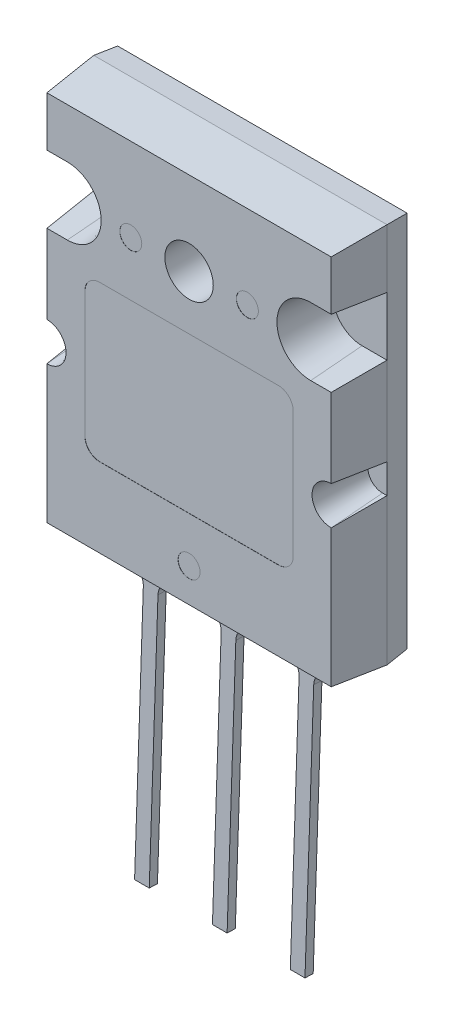
from build123d import *

# Parameters (mm, degrees)
SKETCH1_W                    = 20
SKETCH1_H                    = 26
BOSS_EXTRUDE1_DEPTH          = 1.5
BOSS_EXTRUDE1_DRAFT          = -5
SKETCH1_2_W                  = 20
SKETCH1_2_H                  = 26
BOSS_EXTRUDE2_DEPTH          = 3.5
BOSS_EXTRUDE2_TAPER          = 5
CUT_EXTRUDE1_DEPTH           = 3.5
CUT_EXTRUDE1_TAPER           = -5
CUT_EXTRUDE1_2_DEPTH         = 3.5
CUT_EXTRUDE1_2_TAPER         = -5
CUT_EXTRUDE1_3_DEPTH         = 3.5
CUT_EXTRUDE1_3_TAPER         = -5
CUT_EXTRUDE1_4_DEPTH         = 3.5
CUT_EXTRUDE1_4_TAPER         = -5
CUT_EXTRUDE3_DEPTH           = 17.770509989
CUT_EXTRUDE3_DEPTH_BACK      = 17.770509989
SKETCH5_5_R                  = 1.65
CUT_EXTRUDE4_START           = 3.5
SKETCH5_8_R                  = 0.75
CUT_EXTRUDE4_DEPTH           = 0.01
CUT_EXTRUDE5_START           = -1.5
SKETCH5_9_R                  = 1
CUT_EXTRUDE5_DEPTH           = 1
CUT_EXTRUDE5_DRAFT           = 30
CUT_EXTRUDE5_PROFILE_2_DEPTH = 1
CUT_EXTRUDE5_PROFILE_2_DRAFT = 30
SKETCH6_R                    = 3.5
CUT_EXTRUDE6_DEPTH           = 0.0001
SKETCH7_W                    = 3
SKETCH7_H                    = 0.56
SKETCH7_W_2                  = 2.5
BOSS_EXTRUDE3_DEPTH          = 2.1
SKETCH8_W                    = 1
SKETCH8_H                    = 0.56
BOSS_EXTRUDE4_DEPTH          = 18
FILLET1_R                    = 1


# Read off the part's stored shape, not the designer's step: Cut-Extrude1
with BuildPart() as part:
    # Sketch1 → Boss-Extrude1 (with draft: the straight prism first)
    with BuildSketch(Plane.XY):
        Rectangle(SKETCH1_W, SKETCH1_H)
    extrude(amount=-BOSS_EXTRUDE1_DEPTH)
    # Boss-Extrude1: the draft: its side faces are tilted about the plane it starts from
    boss_extrude1_sides = [part.faces().sort_by_distance(p)[0] for p in [
        (-10, 0, -0.75),
        (0, -13, -0.75),
        (10, 0, -0.75),
        (0, 13, -0.75),
    ]]
    draft(boss_extrude1_sides, Plane.XY, BOSS_EXTRUDE1_DRAFT)

    # Sketch1<2> → Boss-Extrude2 (add)
    with BuildSketch(Plane.XY):
        Rectangle(SKETCH1_2_W, SKETCH1_2_H)
    extrude(amount=BOSS_EXTRUDE2_DEPTH, taper=BOSS_EXTRUDE2_TAPER)

    # Cut-Extrude1 outline → Cut-Extrude1 (cut)
    with BuildSketch(Plane.XY):
        with BuildLine():
            Line((10, -1), (9.693789678, -1))
            ThreePointArc((9.693789678, -1), (8.693789678, -2), (9.693789678, -3))
            Line((9.693789678, -3), (10, -3))
            Line((10, -3), (10, -1))
        make_face()
    extrude(amount=CUT_EXTRUDE1_DEPTH, taper=CUT_EXTRUDE1_TAPER, mode=Mode.SUBTRACT)

    # Cut-Extrude1 2 outline → Cut-Extrude1 2 (cut)
    with BuildSketch(Plane.XY):
        with BuildLine():
            Line((-9.693789678, -1), (-10, -1))
            Line((-10, -1), (-10, -3))
            Line((-10, -3), (-9.693789678, -3))
            ThreePointArc((-9.693789678, -3), (-8.693789678, -2), (-9.693789678, -1))
        make_face()
    extrude(amount=CUT_EXTRUDE1_2_DEPTH, taper=CUT_EXTRUDE1_2_TAPER, mode=Mode.SUBTRACT)

    # Cut-Extrude1 3 outline → Cut-Extrude1 3 (cut)
    with BuildSketch(Plane.XY):
        with BuildLine():
            Line((-8.3, 9), (-10, 9))
            Line((-10, 9), (-10, 5))
            Line((-10, 5), (-8.3, 5))
            ThreePointArc((-8.3, 5), (-6.3, 7), (-8.3, 9))
        make_face()
    extrude(amount=CUT_EXTRUDE1_3_DEPTH, taper=CUT_EXTRUDE1_3_TAPER, mode=Mode.SUBTRACT)

    # Cut-Extrude1 4 outline → Cut-Extrude1 4 (cut)
    with BuildSketch(Plane.XY):
        with BuildLine():
            Line((10, 9), (8.3, 9))
            ThreePointArc((8.3, 9), (6.3, 7), (8.3, 5))
            Line((8.3, 5), (10, 5))
            Line((10, 5), (10, 9))
        make_face()
    extrude(amount=CUT_EXTRUDE1_4_DEPTH, taper=CUT_EXTRUDE1_4_TAPER, mode=Mode.SUBTRACT)

    # Sketch5<5> → Cut-Extrude3 (cut, two sides: drawn at the far end of the back side and taken through both)
    with BuildSketch(Plane.XY.offset(-CUT_EXTRUDE3_DEPTH_BACK)):
        with Locations((0, 7)):
            Circle(SKETCH5_5_R)
    extrude(amount=CUT_EXTRUDE3_DEPTH + CUT_EXTRUDE3_DEPTH_BACK, mode=Mode.SUBTRACT)

    # Sketch5<8> → Cut-Extrude4 (cut)
    with BuildSketch(Plane.XY.offset(CUT_EXTRUDE4_START)):
        with Locations((3.975, 7)):
            Circle(SKETCH5_8_R)
        with Locations((-3.975, 7)):
            Circle(SKETCH5_8_R)
        with Locations((0, -10.4)):
            Circle(SKETCH5_8_R)
        with BuildLine():
            Line((-6.1, 3.3), (6.1, 3.3))
            ThreePointArc((6.1, 3.3), (6.807106781, 3.007106781), (7.1, 2.3))
            Line((7.1, 2.3), (7.1, -6.3))
            ThreePointArc((7.1, -6.3), (6.807106781, -7.007106781), (6.1, -7.3))
            Line((6.1, -7.3), (-6.1, -7.3))
            ThreePointArc((-6.1, -7.3), (-6.807106781, -7.007106781), (-7.1, -6.3))
            Line((-7.1, -6.3), (-7.1, 2.3))
            ThreePointArc((-7.1, 2.3), (-6.807106781, 3.007106781), (-6.1, 3.3))
        make_face()
    extrude(amount=-CUT_EXTRUDE4_DEPTH, mode=Mode.SUBTRACT)


with BuildPart() as cut_extrude5_tool:
    # Sketch5<9> → Cut-Extrude5 (with draft: the straight prism first)
    with BuildSketch(Plane.XY.offset(CUT_EXTRUDE5_START)):
        with Locations((8.3, 7)):
            Circle(SKETCH5_9_R)
    extrude(amount=CUT_EXTRUDE5_DEPTH)
    # Cut-Extrude5: the draft: its side faces are tilted about the plane it starts from
    cut_extrude5_sides = [cut_extrude5_tool.faces().sort_by_distance(p)[0] for p in [
        (7.3, 7, -1),
    ]]
    draft(cut_extrude5_sides, Plane.XY.offset(CUT_EXTRUDE5_START), CUT_EXTRUDE5_DRAFT)


with BuildPart() as part_1:
    add(part.part)

    # Cut-Extrude5: cut by cut_extrude5_tool
    add(cut_extrude5_tool.part, mode=Mode.SUBTRACT)


with BuildPart() as cut_extrude5_profile_2_tool:
    # Sketch5<9> → Cut-Extrude5 profile 2 (with draft: the straight prism first)
    with BuildSketch(Plane.XY.offset(CUT_EXTRUDE5_START)):
        with Locations((-8.3, 7)):
            Circle(SKETCH5_9_R)
    extrude(amount=CUT_EXTRUDE5_PROFILE_2_DEPTH)
    # Cut-Extrude5 profile 2: the draft: its side faces are tilted about the plane it starts from
    cut_extrude5_profile_2_sides = [cut_extrude5_profile_2_tool.faces().sort_by_distance(p)[0] for p in [
        (-9.3, 7, -1),
    ]]
    draft(cut_extrude5_profile_2_sides, Plane.XY.offset(CUT_EXTRUDE5_START), CUT_EXTRUDE5_PROFILE_2_DRAFT)


with BuildPart() as part_2:
    add(part_1.part)

    # Cut-Extrude5 profile 2: cut by cut_extrude5_profile_2_tool
    add(cut_extrude5_profile_2_tool.part, mode=Mode.SUBTRACT)

    # Sketch6 → Cut-Extrude6 (cut)
    with BuildSketch(Plane(origin=(0, 0, -1.5), x_dir=(-1, 0, 0), z_dir=(0, 0, -1))):
        with BuildLine():
            Line((-5.427124344, 11.5), (5.427124344, 11.5))
            ThreePointArc((5.427124344, 11.5), (6.75, 12), (8.072875656, 11.5))
            Line((8.072875656, 11.5), (9, 10.578427125))
            Line((9, 10.578427125), (9, 8.5))
            ThreePointArc((9, 8.5), (7.3, 7), (9, 5.5))
            Line((9, 5.5), (9, -9))
            Line((9, -9), (-9, -9))
            Line((-9, -9), (-9, 5.5))
            ThreePointArc((-9, 5.5), (-7.3, 7), (-9, 8.5))
            Line((-9, 8.5), (-9, 10.578427125))
            Line((-9, 10.578427125), (-8.164213562, 11.414213562))
            ThreePointArc((-8.164213562, 11.414213562), (-6.812653663, 11.999018389), (-5.427124344, 11.5))
        make_face()
        with Locations((0, 7)):
            Circle(SKETCH6_R, mode=Mode.SUBTRACT)
    extrude(amount=-CUT_EXTRUDE6_DEPTH, mode=Mode.SUBTRACT)

    # Sketch7 → Boss-Extrude3 (add)
    with BuildSketch(Plane(origin=(0, -12.800597138, 0.447962854), x_dir=(-1, 0, 0), z_dir=(0, -0.9993882205697596, 0.034974055904479696))):
        with Locations((0, 0.026094538)):
            Rectangle(SKETCH7_W, SKETCH7_H)
        with Locations((-5.31, 0.026094538)):
            Rectangle(SKETCH7_W_2, SKETCH7_H)
        with Locations((5.31, 0.026094538)):
            Rectangle(SKETCH7_W_2, SKETCH7_H)
    extrude(amount=BOSS_EXTRUDE3_DEPTH)

    # Sketch8 → Boss-Extrude4 (add)
    with BuildSketch(Plane(origin=(0, -14.899312401, 0.521408372), x_dir=(1, 0, 0), z_dir=(0, -0.9993882205697596, 0.03497405590447946))):
        with Locations((5.31, -0.026094538)):
            Rectangle(SKETCH8_W, SKETCH8_H)
        with Locations((0, -0.026094538)):
            Rectangle(SKETCH8_W, SKETCH8_H)
        with Locations((-5.31, -0.026094538)):
            Rectangle(SKETCH8_W, SKETCH8_H)
    extrude(amount=BOSS_EXTRUDE4_DEPTH)

    # Fillet1
    # the kernel refuses this fillet: 1 mm, written as the material it adds along each edge
    with BuildSketch(Plane(origin=(4.81, -14.910017769, 0.215501096), x_dir=(-1, 0, 0), z_dir=(0, 0.03497405590447946, 0.9993882205697596)), Plane(origin=(5.81, -14.890432297, 0.7751585), x_dir=(1, 0, 0), z_dir=(0, -0.03497405590447946, -0.9993882205697596)), Plane(origin=(-5.81, -14.910017769, 0.215501096), x_dir=(-1, 0, 0), z_dir=(0, 0.03497405590447946, 0.9993882205697596)), Plane(origin=(-4.81, -14.890432297, 0.7751585), x_dir=(1, 0, 0), z_dir=(0, -0.03497405590447946, -0.9993882205697596))) as fillet1_piece_1:
        with BuildLine():
            CenterArc((1, 0.968245837), FILLET1_R, 180, 75.522487814)
            Line((0, 0.968245837), (-0.02, 0.968245837))
            Line((-0.02, 0.968245837), (-0.02, 0))
            Line((-0.02, 0), (0, -0.02))
            ThreePointArc((0, -0.02), (0.375, -0.02), (0.745, -0.019364917))
            Line((0.745, -0.019364917), (0.75, 0))
        make_face()
    extrude(amount=0.56)
    with BuildSketch(Plane(origin=(0.5, -14.910017769, 0.215501096), x_dir=(1, 0, 0), z_dir=(0, 0.03497405590447946, 0.9993882205697596)), Plane(origin=(-0.5, -14.890432297, 0.7751585), x_dir=(-1, 0, 0), z_dir=(0, -0.03497405590447946, -0.9993882205697596))) as fillet1_piece_2:
        with BuildLine():
            CenterArc((FILLET1_R, -FILLET1_R), FILLET1_R, 90, 90)
            Line((0, -FILLET1_R), (-FILLET1_R * 0.02, -FILLET1_R))
            Line((-FILLET1_R * 0.02, -FILLET1_R), (-FILLET1_R * 0.02, FILLET1_R * 0.02))
            Line((-FILLET1_R * 0.02, FILLET1_R * 0.02), (FILLET1_R, FILLET1_R * 0.02))
            Line((FILLET1_R, FILLET1_R * 0.02), (FILLET1_R, 0))
        make_face()
    extrude(amount=0.56)


solid = part_2.part
